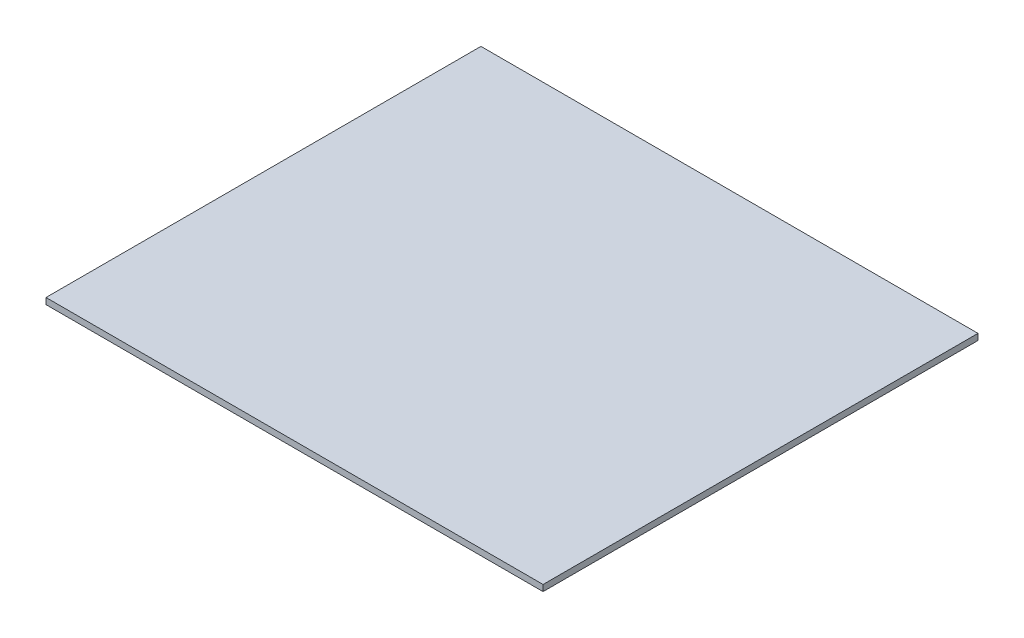
from build123d import *

# Parameters (mm, degrees)
SKETCH2_W           = 400
SKETCH2_H           = 350
BOSS_EXTRUDE1_DEPTH = 5


with BuildPart() as part:
    # Sketch2 → Boss-Extrude1 (new body)
    with BuildSketch(Plane(origin=(0, 0, 0), x_dir=(1, 0, 0), z_dir=(0, 1, 0))):
        with Locations((200, 175)):
            Rectangle(SKETCH2_W, SKETCH2_H)
    extrude(amount=BOSS_EXTRUDE1_DEPTH)


solid = part.part
